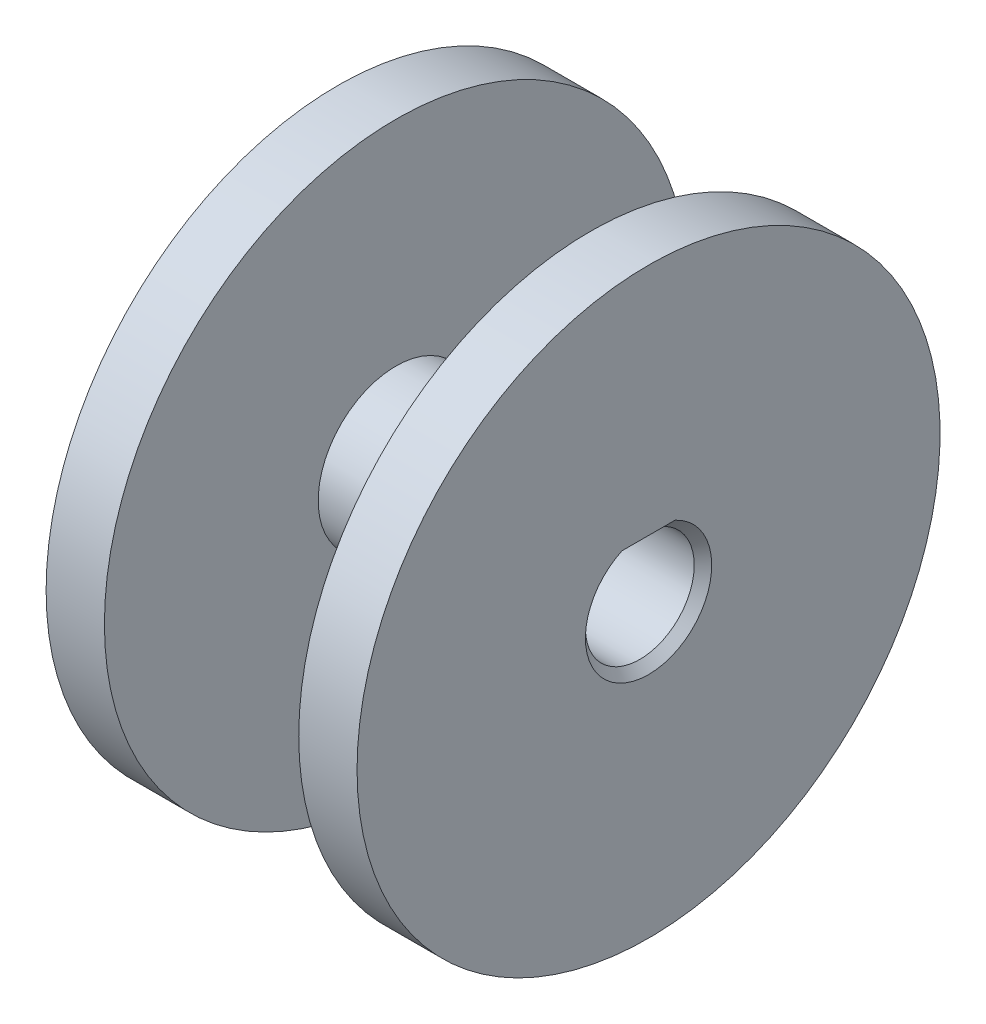
from build123d import *

# Parameters (mm, degrees)
SKETCH1_R                    = 4
FEMALE_SHAFT_DEPTH           = 5
SKETCH6_W                    = 3
SKETCH6_H                    = 15
MALE_SHAFT_INSERT_DEPTH      = 23.671568098
MALE_SHAFT_INSERT_DEPTH_BACK = 23.671568098
CHAMFER1_SIZE                = 0.45


with BuildPart() as part:
    # Sketch1 → Female Shaft (new, symmetric)
    with BuildSketch(Plane(origin=(0, 0, 0), x_dir=(0, 0, -1), z_dir=(1, 0, 0))):
        Circle(SKETCH1_R)
        with BuildLine():
            Line((-1.260952021, 2.5), (1.260952021, 2.5))
            ThreePointArc((1.260952021, 2.5), (0, -2.8), (-1.260952021, 2.5))
        make_face(mode=Mode.SUBTRACT)
    extrude(amount=FEMALE_SHAFT_DEPTH, both=True)

    # Sketch6 → Spool Edge (revolve)
    with BuildSketch(Plane.XY):
        with Locations((6.5, 7.5)):
            Rectangle(SKETCH6_W, SKETCH6_H)
    spool_edge = revolve(axis=Axis((0, 0, 0), (1, 0, 0)))

    # Spool Edge Mirror: Spool Edge across plane
    add(spool_edge.mirror(Plane(origin=(0, 0, 0), x_dir=(0, 0, 1), z_dir=(1, 0, 0))))

    # Sketch1<3> → Male Shaft Insert (cut, two sides: drawn at the far end of the back side and taken through both)
    with BuildSketch(Plane(origin=(0, 0, 0), x_dir=(0, 0, -1), z_dir=(1, 0, 0)).offset(-MALE_SHAFT_INSERT_DEPTH_BACK)):
        with BuildLine():
            Line((1.260952021, 2.5), (-1.260952021, 2.5))
            ThreePointArc((-1.260952021, 2.5), (0, -2.8), (1.260952021, 2.5))
        make_face()
    extrude(amount=MALE_SHAFT_INSERT_DEPTH + MALE_SHAFT_INSERT_DEPTH_BACK, mode=Mode.SUBTRACT)

    # Chamfer1
    chamfer1_edges = [part.edges().sort_by_distance(p)[0] for p in [
        (8, -2.8, 0),
        (8, 2.5, 0),
    ]]
    chamfer(chamfer1_edges, length=CHAMFER1_SIZE)


solid = part.part
